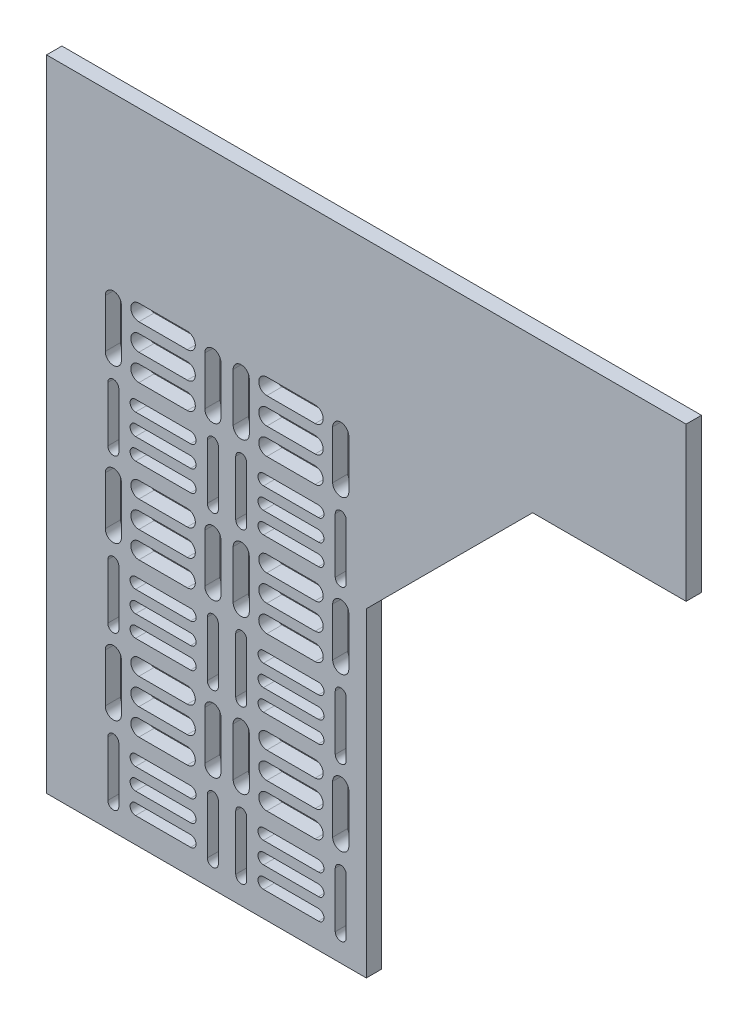
from build123d import *

# Parameters (mm, degrees)
BOSS_EXTRU_1_DEPTH              = 3
ENL_V_MAT_EXTRU_1_DEPTH         = 177.802149308
R_P_TITION_LIN_AIRE1_COUNT      = 2
R_P_TITION_LIN_AIRE1_PITCH      = 25
R_P_TITION_LIN_AIRE1_COUNT_DIR2 = 3
R_P_TITION_LIN_AIRE1_PITCH_DIR2 = 30


with BuildPart() as part:
    # Esquisse1 → Boss.-Extru.1 (new body)
    with BuildSketch(Plane.XY):
        Polygon((0, 125), (0, 0), (62.5, 0), (62.5, 62.5), (95, 95), (125, 95), (125, 125), align=None)
    extrude(amount=BOSS_EXTRU_1_DEPTH)

    # Esquisse2 → Enlèv. mat.-Extru.1 (cut, symmetric)
    with BuildSketch(Plane.XY.offset(3)):
        with BuildLine():
            Line((43.05, 83.7), (52.5, 83.7))
            ThreePointArc((52.5, 83.7), (54.075, 85.275), (52.5, 86.85))
            Line((52.5, 86.85), (43.05, 86.85))
            ThreePointArc((43.05, 86.85), (41.475, 85.275), (43.05, 83.7))
        make_face()
        with BuildLine():
            Line((43.05, 92), (52.5, 92))
            ThreePointArc((52.5, 92), (54.075, 90.425), (52.5, 88.85))
            Line((52.5, 88.85), (43.05, 88.85))
            ThreePointArc((43.05, 88.85), (41.475, 90.425), (43.05, 92))
        make_face()
        with BuildLine():
            Line((59.075, 90), (59.075, 80.55))
            ThreePointArc((59.075, 80.55), (57.5, 78.975), (55.925, 80.55))
            Line((55.925, 80.55), (55.925, 90))
            ThreePointArc((55.925, 90), (57.5, 91.575), (59.075, 90))
        make_face()
        with BuildLine():
            Line((43.05, 78.55), (52.5, 78.55))
            ThreePointArc((52.5, 78.55), (54.075, 80.125), (52.5, 81.7))
            Line((52.5, 81.7), (43.05, 81.7))
            ThreePointArc((43.05, 81.7), (41.475, 80.125), (43.05, 78.55))
        make_face()
        with BuildLine():
            Line((42.4, 75.4), (53.15, 75.4))
            ThreePointArc((53.15, 75.4), (54.225, 74.325), (53.15, 73.25))
            Line((53.15, 73.25), (42.4, 73.25))
            ThreePointArc((42.4, 73.25), (41.325, 74.325), (42.4, 75.4))
        make_face()
        with BuildLine():
            Line((36.475, 90), (36.475, 80.55))
            ThreePointArc((36.475, 80.55), (38.05, 78.975), (39.625, 80.55))
            Line((39.625, 80.55), (39.625, 90))
            ThreePointArc((39.625, 90), (38.05, 91.575), (36.475, 90))
        make_face()
        with BuildLine():
            Line((56.425, 75.55), (56.425, 64.8))
            ThreePointArc((56.425, 64.8), (57.5, 63.725), (58.575, 64.8))
            Line((58.575, 64.8), (58.575, 75.55))
            ThreePointArc((58.575, 75.55), (57.5, 76.625), (56.425, 75.55))
        make_face()
        with BuildLine():
            Line((42.4, 69.1), (53.15, 69.1))
            ThreePointArc((53.15, 69.1), (54.225, 70.175), (53.15, 71.25))
            Line((53.15, 71.25), (42.4, 71.25))
            ThreePointArc((42.4, 71.25), (41.325, 70.175), (42.4, 69.1))
        make_face()
        with BuildLine():
            Line((42.4, 64.95), (53.15, 64.95))
            ThreePointArc((53.15, 64.95), (54.225, 66.025), (53.15, 67.1))
            Line((53.15, 67.1), (42.4, 67.1))
            ThreePointArc((42.4, 67.1), (41.325, 66.025), (42.4, 64.95))
        make_face()
        with BuildLine():
            Line((39.125, 75.55), (39.125, 64.8))
            ThreePointArc((39.125, 64.8), (38.05, 63.725), (36.975, 64.8))
            Line((36.975, 64.8), (36.975, 75.55))
            ThreePointArc((36.975, 75.55), (38.05, 76.625), (39.125, 75.55))
        make_face()
    enl_v_mat_extru_1 = extrude(amount=ENL_V_MAT_EXTRU_1_DEPTH, both=True, mode=Mode.SUBTRACT)

    # Répétition linéaire1: Enl_v. mat.-Extru.1 2 × 3
    with Locations(*[(-i * R_P_TITION_LIN_AIRE1_PITCH, -j * R_P_TITION_LIN_AIRE1_PITCH_DIR2, 0) for i in range(R_P_TITION_LIN_AIRE1_COUNT) for j in range(R_P_TITION_LIN_AIRE1_COUNT_DIR2) if (i, j) != (0, 0)]):
        add(enl_v_mat_extru_1, mode=Mode.SUBTRACT)


solid = part.part
